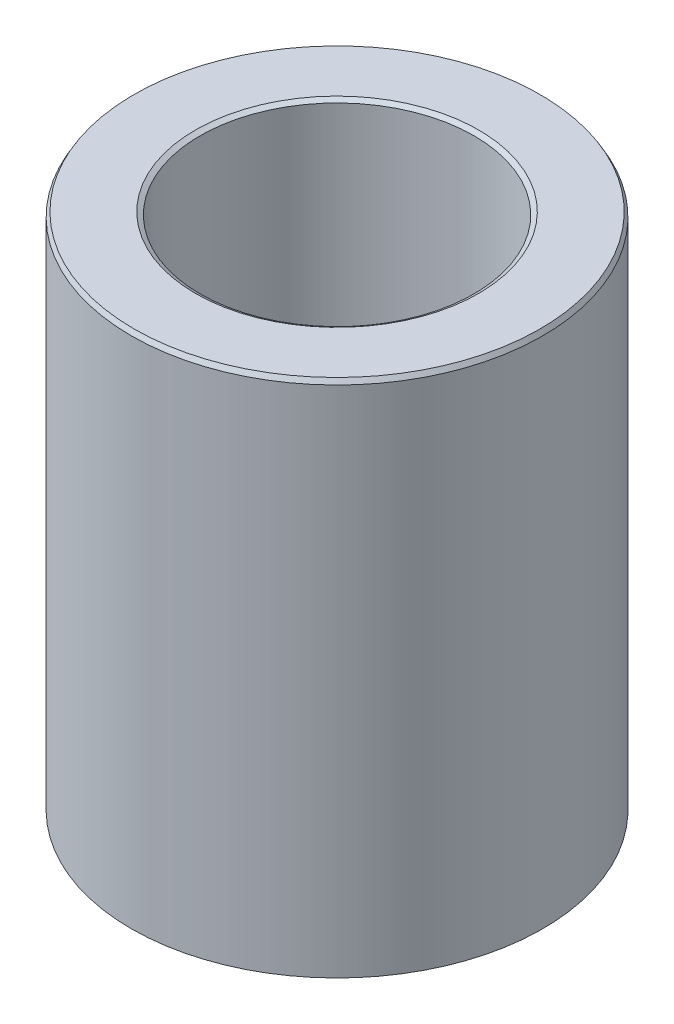
from build123d import *
from OCP.BRepFilletAPI import BRepFilletAPI_MakeChamfer

# Parameters (mm, degrees)
SKETCH1_R           = 40
BOSS_EXTRUDE1_DEPTH = 101.274583562
SKETCH2_R           = 26.634844617
CUT_EXTRUDE1_DEPTH  = 117.002333061
CHAMFER1_SIZE       = 0.9024785
CHAMFER1_SIZE2      = 0.521046205


with BuildPart() as part:
    # Sketch1 → Boss-Extrude1 (new body)
    with BuildSketch(Plane(origin=(0, 0, 0), x_dir=(1, 0, 0), z_dir=(0, 1, 0))):
        Circle(SKETCH1_R)
    extrude(amount=BOSS_EXTRUDE1_DEPTH)

    # Sketch2 → Cut-Extrude1 (cut, through all)
    with BuildSketch(Plane(origin=(0, 0, 0), x_dir=(1, 0, 0), z_dir=(0, 1, 0))):
        Circle(SKETCH2_R)
    extrude(amount=CUT_EXTRUDE1_DEPTH, mode=Mode.SUBTRACT)

    # Chamfer1: one chamfer whose edges measure the first distance from different faces: ONE call of the kernel's chamfer builder (chamfer() names one face for all edges)
    chamfer1_edges_1 = [part.edges().sort_by_distance(p)[0] for p in [
        (-26.634844617, 101.274583562, 0),
    ]]
    chamfer1_side_1 = [part.faces().sort_by_distance(p)[0] for p in [
        (-38.86862915, 101.274583562, 0),
    ]]
    chamfer1_edges_2 = [part.edges().sort_by_distance(p)[0] for p in [
        (-26.634844617, 0, 0),
    ]]
    chamfer1_side_2 = [part.faces().sort_by_distance(p)[0] for p in [
        (-26.634844617, 50.637291781, 0),
    ]]
    chamfer1_edges_3 = [part.edges().sort_by_distance(p)[0] for p in [
        (-40, 0, 0),
    ]]
    chamfer1_side_3 = [part.faces().sort_by_distance(p)[0] for p in [
        (-38.86862915, 0, 0),
    ]]
    chamfer1_edges_4 = [part.edges().sort_by_distance(p)[0] for p in [
        (-40, 101.274583562, 0),
    ]]
    chamfer1_side_4 = [part.faces().sort_by_distance(p)[0] for p in [
        (-40, 50.637291781, 0),
    ]]
    chamfer1 = BRepFilletAPI_MakeChamfer(part.part.solid().wrapped)
    for e in chamfer1_edges_1:
        chamfer1.Add(CHAMFER1_SIZE, CHAMFER1_SIZE2, e.wrapped, chamfer1_side_1[0].wrapped)  # the first distance lies on this face
    for e in chamfer1_edges_2:
        chamfer1.Add(CHAMFER1_SIZE, CHAMFER1_SIZE2, e.wrapped, chamfer1_side_2[0].wrapped)  # the first distance lies on this face
    for e in chamfer1_edges_3:
        chamfer1.Add(CHAMFER1_SIZE, CHAMFER1_SIZE2, e.wrapped, chamfer1_side_3[0].wrapped)  # the first distance lies on this face
    for e in chamfer1_edges_4:
        chamfer1.Add(CHAMFER1_SIZE, CHAMFER1_SIZE2, e.wrapped, chamfer1_side_4[0].wrapped)  # the first distance lies on this face
    add(Compound.cast(chamfer1.Shape()), mode=Mode.REPLACE)


solid = part.part
